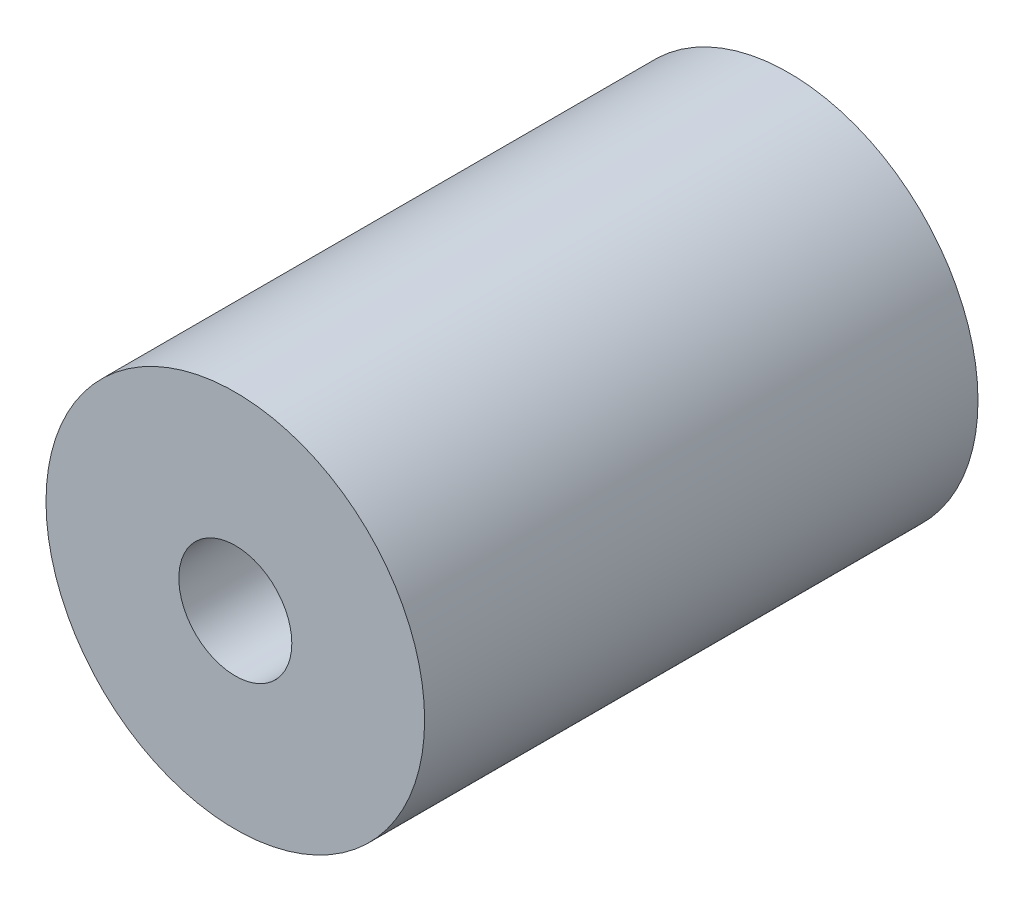
from build123d import *

# Parameters (mm, degrees)
SKETCH1_R           = 8.5527
SKETCH1_R_2         = 2.5527
BOSS_EXTRUDE1_DEPTH = 12.5


with BuildPart() as part:
    # Sketch1 → Boss-Extrude1 (new, symmetric)
    with BuildSketch(Plane.XY):
        Circle(SKETCH1_R)
        Circle(SKETCH1_R_2, mode=Mode.SUBTRACT)
    extrude(amount=BOSS_EXTRUDE1_DEPTH, both=True)


solid = part.part
